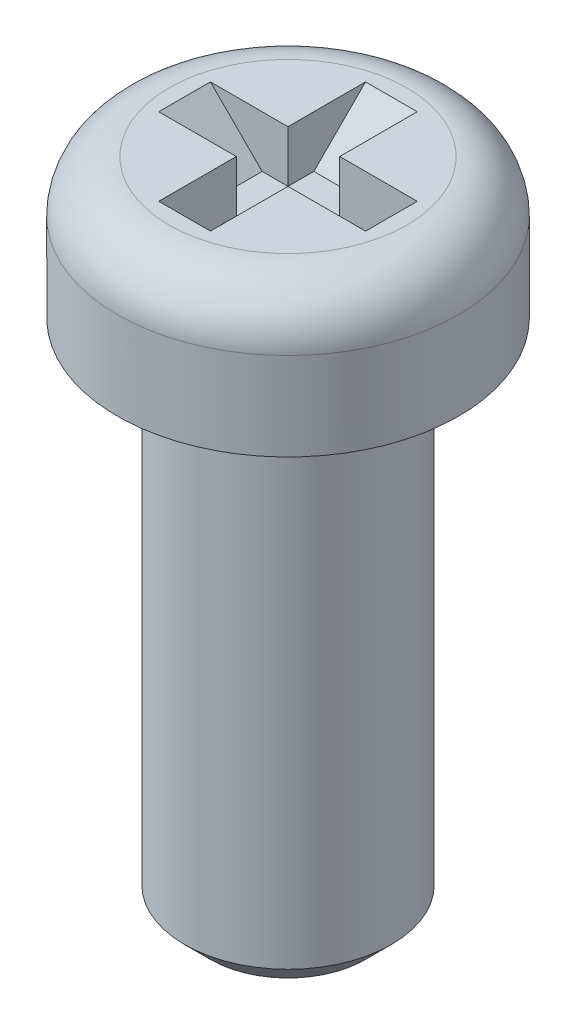
from build123d import *

# Parameters (mm, degrees)
SKETCH_1_R          = 2
EXTRUDE_1_DEPTH     = 10
SKETCH_2_R          = 3.3
EXTRUDE_2_DEPTH     = 2.7
FILLET_1_R          = 1
CHAMFER_1_SIZE      = 0.5
SKETCH_3_W          = 4
SKETCH_3_H          = 1
SKETCH_3_W_2        = 1
SKETCH_3_H_2        = 4
CUT_EXTRUDE_1_DEPTH = 1
CHAMFER_2_SIZE      = 1


with BuildPart() as part:
    # 草图1 → 凸台-拉伸1 (new body)
    with BuildSketch(Plane(origin=(0, 0, 0), x_dir=(1, 0, 0), z_dir=(0, 1, 0))):
        with Locations(Location((0, 0, 0), (0, 0, 270))):
            Circle(SKETCH_1_R)
    extrude(amount=EXTRUDE_1_DEPTH)

    # 草图2 → 凸台-拉伸2 (add)
    with BuildSketch(Plane(origin=(0, 10, 0), x_dir=(1, 0, 0), z_dir=(0, 1, 0))):
        with Locations(Location((0, 0, 0), (0, 0, 90))):
            Circle(SKETCH_2_R)
    extrude(amount=EXTRUDE_2_DEPTH)

    # 圆角1
    fillet_1_edges = [part.edges().sort_by_distance(p)[0] for p in [
        (0, 12.7, 3.3),
    ]]
    fillet(fillet_1_edges, radius=FILLET_1_R)

    # 倒角1
    chamfer_1_edges = [part.edges().sort_by_distance(p)[0] for p in [
        (0, 0, -2),
    ]]
    chamfer(chamfer_1_edges, length=CHAMFER_1_SIZE)

    # 草图3 → 切除-拉伸-薄壁1 (cut)
    with BuildSketch(Plane(origin=(0, 12.7, 0), x_dir=(1, 0, 0), z_dir=(0, 1, 0))):
        Rectangle(SKETCH_3_W, SKETCH_3_H)
        Rectangle(SKETCH_3_W_2, SKETCH_3_H_2)
    extrude(amount=-CUT_EXTRUDE_1_DEPTH, mode=Mode.SUBTRACT)

    # 倒角2
    chamfer_2_edges = [part.edges().sort_by_distance(p)[0] for p in [
        (0, 11.7, 2),
        (2, 11.7, 0),
        (0, 11.7, -2),
        (-2, 11.7, 0),
    ]]
    chamfer(chamfer_2_edges, length=CHAMFER_2_SIZE - 0.0001)  # a hair under: the kernel refuses the full size


solid = part.part
